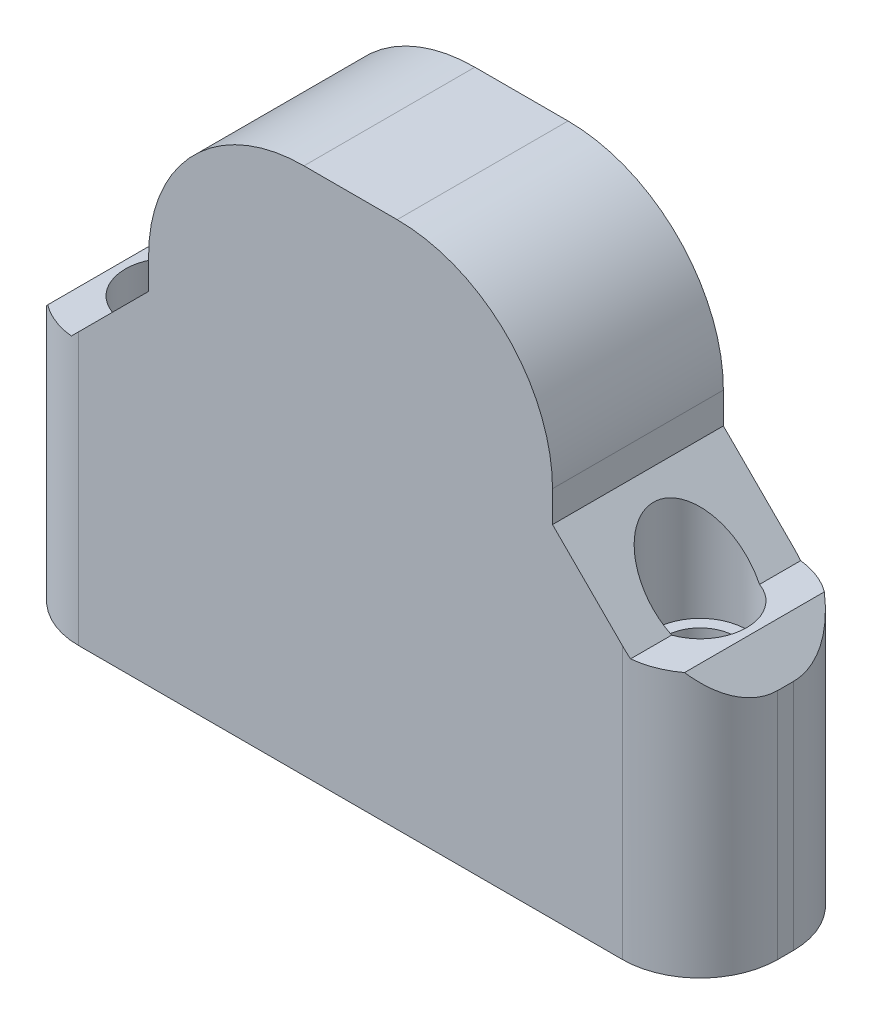
from build123d import *

# Parameters (mm, degrees)
CROQUIS1_R                                           = 8.5
SALIENTE_EXTRUIR1_DEPTH                              = 6
SALIENTE_EXTRUIR2_DEPTH                              = 5
REFRENTADO_PARA_TORNILLO_CON_CABEZA_TRON_D           = 4.5
REFRENTADO_PARA_TORNILLO_CON_CABEZA_TRON_CBORE_D     = 6
REFRENTADO_PARA_TORNILLO_CON_CABEZA_TRON_CBORE_DEPTH = 3.1
CHAFL_N1_SIZE                                        = 5
REDONDEO1_R                                          = 10
CHAFL_N2_SIZE                                        = 2
REDONDEO2_R                                          = 5
REDONDEO3_R                                          = 5
REDONDEO4_R                                          = 5
REDONDEO5_R                                          = 5


with BuildPart() as part:
    # Croquis1 → Saliente-Extruir1 (new body)
    with BuildSketch(Plane.XY):
        Polygon((-22.5, 0), (22.5, 0), (22.5, 17), (13, 17), (13, 34), (-13, 34), (-13, 17), (-22.5, 17), align=None)
        with Locations((0, 22)):
            Circle(CROQUIS1_R, mode=Mode.SUBTRACT)
    extrude(amount=SALIENTE_EXTRUIR1_DEPTH)

    # Croquis2 → Saliente-Extruir2 (add)
    with BuildSketch(Plane.XY.offset(6)):
        Polygon((22.5, 0), (22.5, 17), (13, 17), (13, 34), (-13, 34), (-13, 17), (-22.5, 17), (-22.5, 0), align=None)
    extrude(amount=SALIENTE_EXTRUIR2_DEPTH)

    # Refrentado para tornillo con cabeza troncocónica de M41 (through all)
    with Locations(Plane(origin=(17, 17, 5.5), x_dir=(1, 0, 0), z_dir=(0, 1, 0))):
        with Locations((0, 0), (-34, 0)):
            CounterBoreHole(REFRENTADO_PARA_TORNILLO_CON_CABEZA_TRON_D / 2, REFRENTADO_PARA_TORNILLO_CON_CABEZA_TRON_CBORE_D / 2, REFRENTADO_PARA_TORNILLO_CON_CABEZA_TRON_CBORE_DEPTH)

    # Chaflán1
    # the kernel refuses this chamfer: 5 mm, written as the material it adds along each edge
    with BuildSketch(Plane(origin=(-13, 17, 11), x_dir=(-0.9996219169112968, -0.02749587661058561, 0), z_dir=(0, 0, -1))) as chafl_n1_piece_1_section:
        Polygon((CHAFL_N1_SIZE * 0.999621916911, CHAFL_N1_SIZE * 0.0274958766106), (-CHAFL_N1_SIZE * 0.0274958766106, CHAFL_N1_SIZE * 0.999621916911), (0, 0), align=None)
    chafl_n1_piece_1 = extrude(amount=11, mode=Mode.PRIVATE)
    chafl_n1_piece_1 = chafl_n1_piece_1 - Plane(origin=(-17, 17.70483049, 5.5), x_dir=(1, 0, 0), z_dir=(0, 1, 0)) * Cylinder(3, 42, mode=Mode.PRIVATE)
    add(chafl_n1_piece_1)
    with BuildSketch(Plane(origin=(13, 17, 0), x_dir=(0.9996219169112968, -0.027495876610585626, 0), z_dir=(0, 0, 1))) as chafl_n1_piece_2_section:
        Polygon((CHAFL_N1_SIZE * 0.999621916911, CHAFL_N1_SIZE * 0.0274958766106), (-CHAFL_N1_SIZE * 0.0274958766106, CHAFL_N1_SIZE * 0.999621916911), (0, 0), align=None)
    chafl_n1_piece_2 = extrude(amount=11, mode=Mode.PRIVATE)
    chafl_n1_piece_2 = chafl_n1_piece_2 - Plane(origin=(17, 17.70483049, 5.5), x_dir=(1, 0, 0), z_dir=(0, 1, 0)) * Cylinder(3, 42, mode=Mode.PRIVATE)
    add(chafl_n1_piece_2)

    # Redondeo1
    redondeo1_edges = [part.edges().sort_by_distance(p)[0] for p in [
        (-13, 34, 5.5),
        (13, 34, 5.5),
    ]]
    fillet(redondeo1_edges, radius=REDONDEO1_R)

    # Chaflán2
    chafl_n2_edges = [part.edges().sort_by_distance(p)[0] for p in [
        (-22.5, 17, 5.5),
        (22.5, 17, 5.5),
    ]]
    chamfer(chafl_n2_edges, length=CHAFL_N2_SIZE)

    # Redondeo2
    # the kernel refuses this fillet: 5 mm, written as the material it takes off along each edge
    with BuildSketch(Plane(origin=(22.5, -12.5, 11), x_dir=(0, 0, -1), z_dir=(0, 1, 0))) as redondeo2_piece_1:
        with BuildLine():
            CenterArc((REDONDEO2_R, REDONDEO2_R), REDONDEO2_R, 180, 90)
            Line((0, REDONDEO2_R), (0, 0))
            Line((0, 0), (REDONDEO2_R, 0))
        make_face()
    extrude(amount=40, mode=Mode.SUBTRACT)

    # Redondeo3
    redondeo3_edges = [part.edges().sort_by_distance(p)[0] for p in [
        (-22.5, 7.5, 0),
    ]]
    fillet(redondeo3_edges, radius=REDONDEO3_R)

    # Redondeo4
    # the kernel refuses this fillet: 5 mm, written as the material it takes off along each edge
    with BuildSketch(Plane(origin=(22.5, -12.5, 0), x_dir=(-1, 0, 0), z_dir=(0, 1, 0))) as redondeo4_piece_1:
        with BuildLine():
            CenterArc((REDONDEO4_R, REDONDEO4_R), REDONDEO4_R, 180, 90)
            Line((0, REDONDEO4_R), (0, 0))
            Line((0, 0), (REDONDEO4_R, 0))
        make_face()
    extrude(amount=40, mode=Mode.SUBTRACT)

    # Redondeo5
    # the kernel refuses this fillet: 5 mm, written as the material it takes off along each edge
    with BuildSketch(Plane(origin=(-22.5, 27.5, 11), x_dir=(0, 0, -1), z_dir=(0, -1, 0))) as redondeo5_piece_1:
        with BuildLine():
            CenterArc((REDONDEO5_R, REDONDEO5_R), REDONDEO5_R, 180, 90)
            Line((0, REDONDEO5_R), (0, 0))
            Line((0, 0), (REDONDEO5_R, 0))
        make_face()
    extrude(amount=40, mode=Mode.SUBTRACT)


solid = part.part
